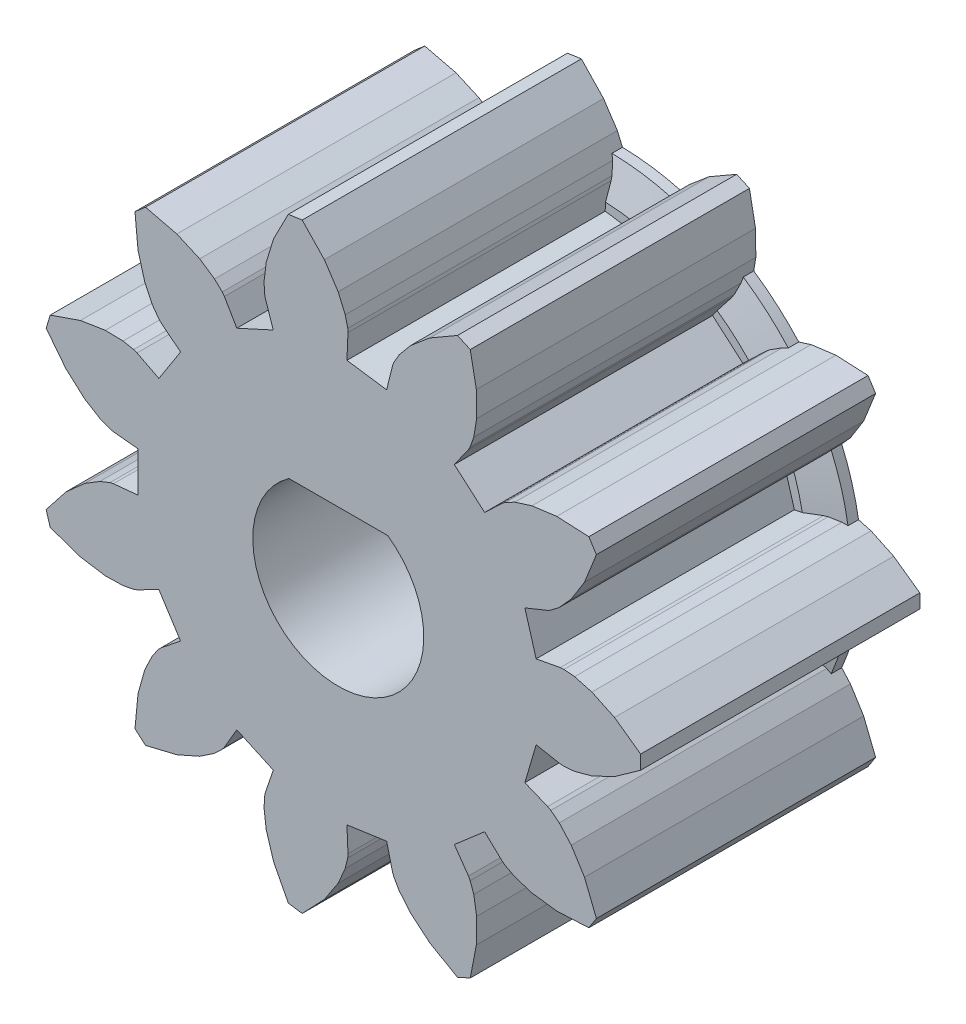
from build123d import *
from OCP.BRepFilletAPI import BRepFilletAPI_MakeChamfer

# Parameters (mm, degrees)
BOSS_EXTRUDE1_DEPTH = 8
CUT_EXTRUDE1_DEPTH  = 15.597729686
CHAMFER1_SIZE       = 1
CHAMFER1_SIZE2      = 0.577350269


with BuildPart() as part:
    # Model → Boss-Extrude1 (new body)
    with BuildSketch(Plane.XY):
        Polygon((-8.37, -2.248), (-7.801, -1.524), (-7.265, -1.048), (-6.829, -0.78), (-6.543, -0.667), (-6.442, -0.645), (-5.741, -0.575), (-5.741, 0.575), (-6.442, 0.645), (-6.543, 0.667), (-6.829, 0.78), (-7.265, 1.048), (-7.801, 1.524), (-8.37, 2.248), (-8.256, 2.634), (-7.386, 2.935), (-6.678, 3.046), (-6.167, 3.035), (-5.865, 2.976), (-5.768, 2.94), (-5.14, 2.62), (-4.518, 3.587), (-5.071, 4.026), (-5.143, 4.099), (-5.323, 4.348), (-5.545, 4.81), (-5.738, 5.5), (-5.826, 6.416), (-5.522, 6.679), (-4.627, 6.462), (-3.971, 6.173), (-3.547, 5.887), (-3.325, 5.674), (-3.263, 5.592), (-2.908, 4.983), (-1.862, 5.461), (-2.089, 6.128), (-2.111, 6.229), (-2.127, 6.536), (-2.064, 7.044), (-1.854, 7.729), (-1.432, 8.547), (-1.034, 8.604), (-0.399, 7.938), (-0.004, 7.34), (0.199, 6.87), (0.271, 6.571), (0.278, 6.468), (0.248, 5.764), (1.386, 5.601), (1.555, 6.285), (1.592, 6.381), (1.744, 6.648), (2.071, 7.042), (2.619, 7.504), (3.416, 7.965), (3.782, 7.798), (3.956, 6.893), (3.965, 6.177), (3.882, 5.672), (3.78, 5.382), (3.731, 5.291), (3.325, 4.715), (4.194, 3.962), (4.706, 4.446), (4.789, 4.508), (5.062, 4.65), (5.55, 4.804), (6.26, 4.897), (7.18, 4.853), (7.397, 4.515), (7.055, 3.66), (6.675, 3.053), (6.332, 2.673), (6.09, 2.484), (6, 2.434), (5.347, 2.169), (5.67, 1.066), (6.363, 1.196), (6.466, 1.203), (6.772, 1.175), (7.266, 1.041), (7.914, 0.735), (8.664, 0.201), (8.664, -0.201), (7.914, -0.735), (7.266, -1.041), (6.772, -1.175), (6.466, -1.203), (6.363, -1.196), (5.67, -1.066), (5.346, -2.169), (6, -2.434), (6.09, -2.484), (6.332, -2.673), (6.675, -3.053), (7.055, -3.66), (7.397, -4.515), (7.18, -4.853), (6.26, -4.897), (5.55, -4.804), (5.062, -4.65), (4.789, -4.508), (4.706, -4.446), (4.194, -3.962), (3.325, -4.715), (3.731, -5.291), (3.78, -5.382), (3.882, -5.672), (3.965, -6.177), (3.956, -6.893), (3.782, -7.798), (3.416, -7.965), (2.619, -7.504), (2.071, -7.042), (1.744, -6.648), (1.592, -6.381), (1.555, -6.285), (1.386, -5.601), (0.248, -5.764), (0.278, -6.468), (0.271, -6.571), (0.199, -6.87), (-0.004, -7.34), (-0.399, -7.938), (-1.034, -8.604), (-1.432, -8.547), (-1.854, -7.729), (-2.064, -7.044), (-2.127, -6.536), (-2.111, -6.229), (-2.089, -6.128), (-1.862, -5.461), (-2.908, -4.983), (-3.263, -5.592), (-3.325, -5.674), (-3.547, -5.887), (-3.971, -6.173), (-4.627, -6.462), (-5.522, -6.679), (-5.826, -6.416), (-5.738, -5.5), (-5.545, -4.81), (-5.323, -4.348), (-5.143, -4.099), (-5.071, -4.026), (-4.519, -3.587), (-5.141, -2.62), (-5.768, -2.94), (-5.865, -2.976), (-6.167, -3.035), (-6.678, -3.046), (-7.386, -2.935), (-8.256, -2.634), align=None)
    extrude(amount=BOSS_EXTRUDE1_DEPTH)

    # Sketch2 → Cut-Extrude1 (cut, through all)
    with BuildSketch(Plane.XY.offset(8)):
        with BuildLine():
            Line((-1.41509717, 2), (1.41509717, 2))
            ThreePointArc((1.41509717, 2), (0, -2.45), (-1.41509717, 2))
        make_face()
    extrude(amount=-CUT_EXTRUDE1_DEPTH, mode=Mode.SUBTRACT)

    # Sketch3 → Revolve1 (revolve)
    with BuildSketch(Plane(origin=(0, 0, 0), x_dir=(1, 0, 0), z_dir=(0, 1, 0))):
        Polygon((3.2, 0), (3.2, -0.6), (6, -0.6), (7, -0.3), (7, 0), align=None)
    revolve(axis=Axis((0, 0, 0), (0, 0, 1)))

    # Chamfer1: one chamfer whose edges measure the first distance from different faces: ONE call of the kernel's chamfer builder (chamfer() names one face for all edges)
    chamfer1_edges_1 = [part.edges().sort_by_distance(p)[0] for p in [
        (0, 2, 0),
    ]]
    chamfer1_side_1 = [part.faces().sort_by_distance(p)[0] for p in [
        (0, 2, 4),
    ]]
    chamfer1_edges_2 = [part.edges().sort_by_distance(p)[0] for p in [
        (0, -2.45, 0),
    ]]
    chamfer1_side_2 = [part.faces().sort_by_distance(p)[0] for p in [
        (0, -2.45, 4),
    ]]
    chamfer1 = BRepFilletAPI_MakeChamfer(part.part.solid().wrapped)
    for e in chamfer1_edges_1:
        chamfer1.Add(CHAMFER1_SIZE, CHAMFER1_SIZE2, e.wrapped, chamfer1_side_1[0].wrapped)  # the first distance lies on this face
    for e in chamfer1_edges_2:
        chamfer1.Add(CHAMFER1_SIZE, CHAMFER1_SIZE2, e.wrapped, chamfer1_side_2[0].wrapped)  # the first distance lies on this face
    add(Compound.cast(chamfer1.Shape()), mode=Mode.REPLACE)


solid = part.part
